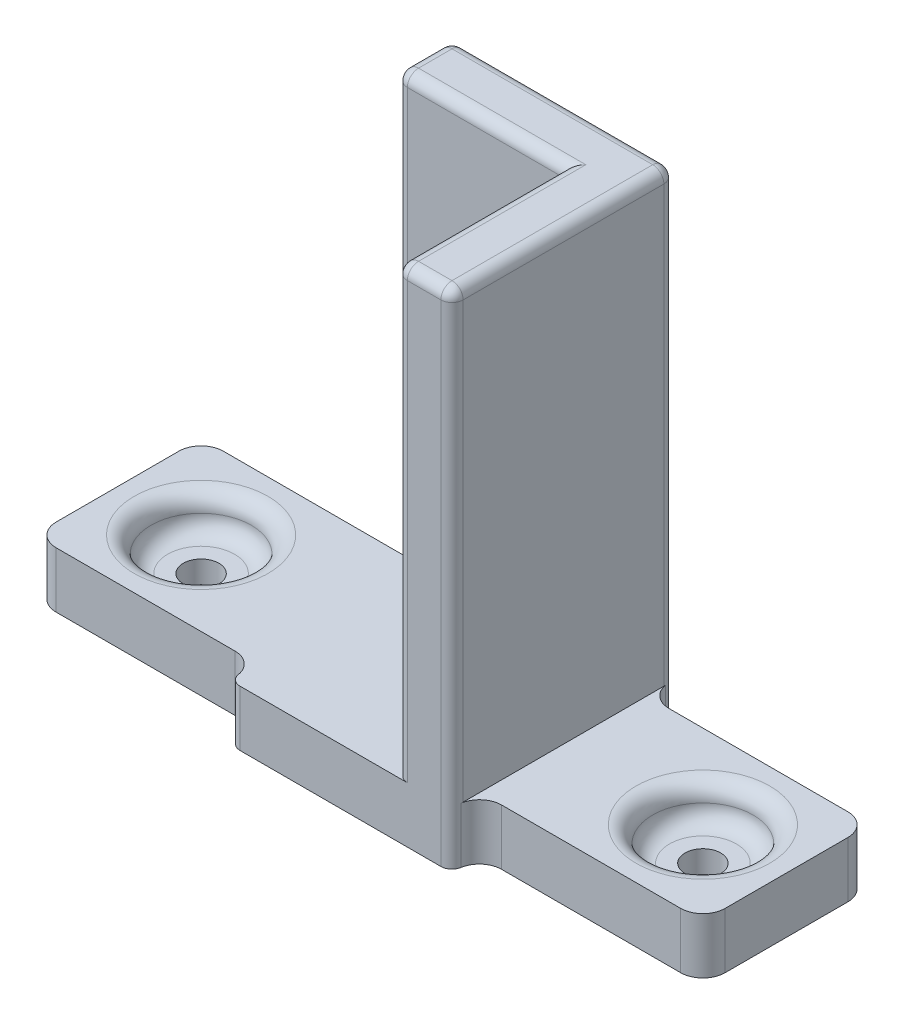
from build123d import *

# Parameters (mm, degrees)
SKETCH1_W           = 20
SKETCH1_H           = 20
BOSS_EXTRUDE1_DEPTH = 5
BOSS_EXTRUDE2_DEPTH = 40
FILLET1_R           = 1
FILLET2_R           = 1
SKETCH3_R           = 2.5
CUT_EXTRUDE1_DEPTH  = 3.2
SKETCH4_R           = 2.5
CUT_EXTRUDE2_DEPTH  = 3.2
SKETCH5_R           = 2.5
CUT_EXTRUDE3_DEPTH  = 3.2
FILLET3_R           = 0.5
FILLET4_R           = 1
SKETCH6_W           = 20
SKETCH6_H           = 15
BOSS_EXTRUDE3_DEPTH = 5
FILLET5_R           = 2
FILLET6_R           = 2
SKETCH7_R           = 4.5
CUT_EXTRUDE4_DEPTH  = 3
FILLET7_R           = 1.5
SKETCH8_R           = 1.6
CUT_EXTRUDE5_DEPTH  = 63.040309477


# Some blends are built 0.0001 mm under size
with BuildPart() as part:
    # Sketch1 → Boss-Extrude1 (new body)
    with BuildSketch(Plane(origin=(0, 0, 0), x_dir=(1, 0, 0), z_dir=(0, 1, 0))):
        with Locations((10, 10)):
            Rectangle(SKETCH1_W, SKETCH1_H)
    extrude(amount=BOSS_EXTRUDE1_DEPTH)

    # Sketch2 → Boss-Extrude2 (add)
    with BuildSketch(Plane(origin=(0, 5, 0), x_dir=(1, 0, 0), z_dir=(0, 1, 0))):
        Polygon((0, 20), (20, 20), (20, 0), (15, 0), (15, 15), (0, 15), align=None)
    extrude(amount=BOSS_EXTRUDE2_DEPTH)

    # Fillet1
    fillet1_edges = [part.edges().sort_by_distance(p)[0] for p in [
        (0, 25, -15),
        (15, 25, 0),
        (0, 2.5, 0),
    ]]
    fillet(fillet1_edges, radius=FILLET1_R)

    # Fillet2
    fillet2_edges = [part.edges().sort_by_distance(p)[0] for p in [
        (0, 22.5, -20),
        (20, 22.5, -20),
        (20, 22.5, 0),
    ]]
    fillet(fillet2_edges, radius=FILLET2_R)

    # Sketch3 → Cut-Extrude1 (cut)
    with BuildSketch(Plane(origin=(0, 5, 0), x_dir=(1, 0, 0), z_dir=(0, 1, 0))):
        with Locations(Location((10, 10, 0), (0, 0, 270))):
            Circle(SKETCH3_R)
    extrude(amount=-CUT_EXTRUDE1_DEPTH, mode=Mode.SUBTRACT)

    # Sketch4 → Cut-Extrude2 (cut)
    with BuildSketch(Plane.XY.offset(-15)):
        with Locations((10, 15)):
            Circle(SKETCH4_R)
        with Locations((10, 35)):
            Circle(SKETCH4_R)
    extrude(amount=-CUT_EXTRUDE2_DEPTH, mode=Mode.SUBTRACT)

    # Sketch5 → Cut-Extrude3 (cut)
    with BuildSketch(Plane.ZY.offset(-15)):
        with Locations((-10, 15)):
            Circle(SKETCH5_R)
        with Locations((-10, 35)):
            Circle(SKETCH5_R)
    extrude(amount=-CUT_EXTRUDE3_DEPTH, mode=Mode.SUBTRACT)

    # Fillet3
    fillet3_edges = [part.edges().sort_by_distance(p)[0] for p in [
        (10, 5, -12.5),
        (7.5, 15, -15),
        (7.5, 35, -15),
        (15, 15, -12.5),
        (15, 35, -12.5),
    ]]
    fillet(fillet3_edges, radius=FILLET3_R)

    # Fillet4
    fillet4_edges = [part.edges().sort_by_distance(p)[0] for p in [
        (15, 45, -8),
        (8, 45, -15),
        (17.5, 45, 0),
        (15.292893219, 45, -0.292893219),
        (0.292893219, 45, -15.292893219),
        (10, 45, -20),
        (20, 45, -10),
        (0, 45, -17.5),
        (19.707106781, 45, -0.292893219),
        (0.292893219, 45, -19.707106781),
        (19.707106781, 45, -19.707106781),
    ]]
    fillet(fillet4_edges, radius=FILLET4_R)

    # Sketch6 → Boss-Extrude3 (add)
    with BuildSketch(Plane(origin=(0, 0, 0), x_dir=(1, 0, 0), z_dir=(0, 1, 0))):
        with Locations((-10, 10)):
            Rectangle(SKETCH6_W, SKETCH6_H)
        with Locations((30, 10)):
            Rectangle(SKETCH6_W, SKETCH6_H)
    extrude(amount=BOSS_EXTRUDE3_DEPTH)

    # Fillet5
    # the kernel refuses this fillet: 2 mm, written as the material it adds along each edge
    with BuildSketch(Plane(origin=(0, 0, -17.5), x_dir=(0.00839172619726849, 0, -0.9999647888458023), z_dir=(0, 1, 0)), Plane(origin=(20, 0, -2.5), x_dir=(-0.008391726197268362, 0, 0.9999647888458023), z_dir=(0, 1, 0))) as fillet5_piece_1:
        with BuildLine():
            CenterArc((1.983498243, 1.974754399), FILLET5_R, 180.480816137, 80.405931773)
            Line((-0.016431335, 1.957970947), (-0.216424292, 1.956292601))
            Line((-0.216424292, 1.956292601), (-0.199992958, -0.001678345))
            Line((-0.199992958, -0.001678345), (0.001678345, -0.199992958))
            ThreePointArc((0.001678345, -0.199992958), (1.501625529, -0.187405368), (1.635048065, -0.19747544))
            Line((1.635048065, -0.19747544), (1.666725354, 0))
        make_face()
    extrude(amount=5)
    with BuildSketch(Plane(origin=(0, 0, -2.5), x_dir=(0.00839172619726729, 0, 0.9999647888458023), z_dir=(0, 1, 0)), Plane(origin=(20, 0, -17.5), x_dir=(-0.008391726197268357, 0, -0.9999647888458023), z_dir=(0, 1, 0))) as fillet5_piece_2:
        with BuildLine():
            CenterArc((1.983498243, -1.974754399), FILLET5_R, 99.11325209, 80.405931773)
            Line((-0.016431335, -1.957970947), (-0.216424292, -1.956292601))
            Line((-0.216424292, -1.956292601), (-0.199992958, 0.001678345))
            Line((-0.199992958, 0.001678345), (0.001678345, 0.199992958))
            ThreePointArc((0.001678345, 0.199992958), (1.501625529, 0.187405368), (1.635048065, 0.19747544))
            Line((1.635048065, 0.19747544), (1.666725354, 0))
        make_face()
    extrude(amount=5)

    # Fillet6
    fillet6_edges = [part.edges().sort_by_distance(p)[0] for p in [
        (-20, 2.5, -2.5),
        (-20, 2.5, -17.5),
        (40, 2.5, -17.5),
        (40, 2.5, -2.5),
    ]]
    fillet(fillet6_edges, radius=FILLET6_R)

    # Sketch7 → Cut-Extrude4 (cut)
    with BuildSketch(Plane(origin=(0, 5, 0), x_dir=(1, 0, 0), z_dir=(0, 1, 0))):
        with Locations(Location((-12.5, 10, 0), (0, 0, 270))):
            Circle(SKETCH7_R)
        with Locations(Location((32.5, 10, 0), (0, 0, 270))):
            Circle(SKETCH7_R)
    extrude(amount=-CUT_EXTRUDE4_DEPTH, mode=Mode.SUBTRACT)

    # Fillet7
    fillet7_edges = [part.edges().sort_by_distance(p)[0] for p in [
        (-12.5, 2, -14.5),
        (-12.5, 5, -14.5),
        (32.5, 2, -14.5),
        (32.5, 5, -14.5),
    ]]
    fillet(fillet7_edges, radius=FILLET7_R - 0.0001)  # a hair under: the kernel refuses the full size

    # Sketch8 → Cut-Extrude5 (cut, through all)
    with BuildSketch(Plane(origin=(0, 2, 0), x_dir=(1, 0, 0), z_dir=(0, 1, 0))):
        with Locations(Location((-12.5, 10, 0), (0, 0, 270))):
            Circle(SKETCH8_R)
        with Locations(Location((32.5, 10, 0), (0, 0, 270))):
            Circle(SKETCH8_R)
    extrude(amount=-CUT_EXTRUDE5_DEPTH, mode=Mode.SUBTRACT)


solid = part.part
